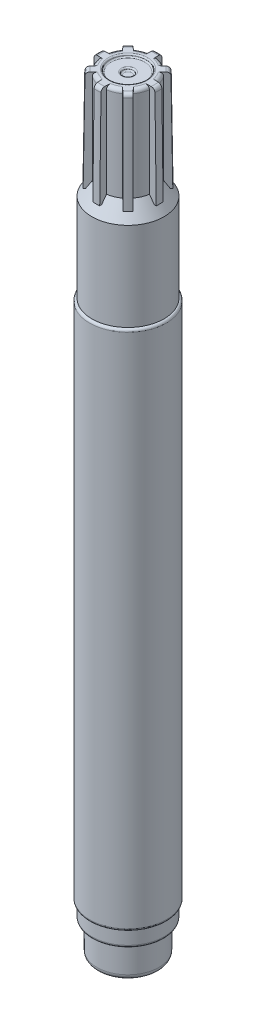
from build123d import *

# Parameters (mm, degrees)
FILLET1_R          = 0.475
CIRPATTERN1_COUNT  = 8
FILLET2_R          = 0.687
SKETCH6_R          = 3.43
CUT_EXTRUDE1_DEPTH = 0.5
SKETCH7_R          = 1
CUT_EXTRUDE2_DEPTH = 0.5
FILLET3_R          = 0.25
FILLET4_R          = 1
SKETCH8_W          = 0.43
SKETCH8_H          = 98.15
FILLET5_R          = 0.475


# Some blends are built 0.0001 mm under size
with BuildPart() as part:
    # Sketch2 → Revolve1 (revolve)
    with BuildSketch(Plane.XY, mode=Mode.PRIVATE) as revolve1_sk:
        Polygon((0, 72.25), (0, -72.25), (5.83, -72.25), (5.83, -66.25), (6.785, -66.25), (6.785, 51.55), (4.8, 54.55), (4.8, 72.25), align=None)
    revolve(revolve1_sk.sketch.rotate(Axis((0, 72.25, 0), (0, -1, 0)), 180), axis=Axis((0, 72.25, 0), (0, -1, 0)))

    # Fillet1
    fillet1_edges = [part.edges().sort_by_distance(p)[0] for p in [
        (6.785, -66.25, 0),
        (5.83, -66.25, 0),
    ]]
    fillet(fillet1_edges, radius=FILLET1_R)


with BuildPart() as body_2:
    # Sketch4 for Loft1 → Loft1 section 0
    with BuildSketch(Plane(origin=(0, 72.25, 0), x_dir=(1, 0, 0), z_dir=(0, 1, 0))):
        with BuildLine():
            Line((4.748684028, 0.7), (5.713142743, 0.65))
            # circular arc as an exact rational Bezier (weights 1, cos(half-angle), 1)
            Bezier((5.713142743, 0.65), (5.787095035, 0), (5.713142743, -0.65), weights=[1, 0.993590042, 1])
            Line((5.713142743, -0.65), (4.748684028, -0.7))
            Bezier((4.748684028, -0.7), (4.85187051, 0), (4.748684028, 0.7), weights=[1, 0.989309173, 1])
        make_face()
    # Sketch5 for Loft1 → Loft1 section 1
    with BuildSketch(Plane(origin=(0, 53.25, 0), x_dir=(1, 0, 0), z_dir=(0, 1, 0))):
        with BuildLine():
            Line((4.748684028, 0.7), (5.964687754, 0.65))
            Bezier((5.964687754, 0.65), (6.035521302, 0), (5.964687754, -0.65), weights=[1, 0.994114626, 1])
            Line((5.964687754, -0.65), (4.748684028, -0.7))
            Bezier((4.748684028, -0.7), (4.85187051, 0), (4.748684028, 0.7), weights=[1, 0.989309173, 1])
        make_face()
    loft()


with BuildPart() as cirpattern1_1:
    # CirPattern1: pattern copy
    add(body_2.part.rotate(Axis((0, 24.52235385, 0), (0, -1, 0)), 1 * 360 / CIRPATTERN1_COUNT))


with BuildPart() as cirpattern1_2:
    # CirPattern1: pattern copy
    add(body_2.part.rotate(Axis((0, 24.52235385, 0), (0, -1, 0)), 2 * 360 / CIRPATTERN1_COUNT))


with BuildPart() as cirpattern1_3:
    # CirPattern1: pattern copy
    add(body_2.part.rotate(Axis((0, 24.52235385, 0), (0, -1, 0)), 3 * 360 / CIRPATTERN1_COUNT))


with BuildPart() as cirpattern1_4:
    # CirPattern1: pattern copy
    add(body_2.part.rotate(Axis((0, 24.52235385, 0), (0, -1, 0)), 4 * 360 / CIRPATTERN1_COUNT))


with BuildPart() as cirpattern1_5:
    # CirPattern1: pattern copy
    add(body_2.part.rotate(Axis((0, 24.52235385, 0), (0, -1, 0)), 5 * 360 / CIRPATTERN1_COUNT))


with BuildPart() as cirpattern1_6:
    # CirPattern1: pattern copy
    add(body_2.part.rotate(Axis((0, 24.52235385, 0), (0, -1, 0)), 6 * 360 / CIRPATTERN1_COUNT))


with BuildPart() as cirpattern1_7:
    # CirPattern1: pattern copy
    add(body_2.part.rotate(Axis((0, 24.52235385, 0), (0, -1, 0)), 7 * 360 / CIRPATTERN1_COUNT))


with BuildPart() as part_1:
    add(part.part)

    # Combine1: union body 2, CirPattern1_1, CirPattern1_2, CirPattern1_3, CirPattern1_4, CirPattern1_5, CirPattern1_6, CirPattern1_7
    add(body_2.part)
    add(cirpattern1_1.part)
    add(cirpattern1_2.part)
    add(cirpattern1_3.part)
    add(cirpattern1_4.part)
    add(cirpattern1_5.part)
    add(cirpattern1_6.part)
    add(cirpattern1_7.part)

    # Fillet2
    fillet2_edges = [part_1.edges().sort_by_distance(p)[0] for p in [
        (-4.434621756, 72.25, 1.836880475),
        (-5.75, 72.25, 0),
        (-4.434621756, 72.25, -1.836880475),
        (-4.065863992, 72.25, -4.065863992),
        (-1.836880475, 72.25, -4.434621756),
        (0, 72.25, -5.75),
        (1.836880475, 72.25, -4.434621756),
        (4.065863992, 72.25, -4.065863992),
        (4.434621756, 72.25, -1.836880475),
        (5.75, 72.25, 0),
        (4.434621756, 72.25, 1.836880475),
        (4.065863992, 72.25, 4.065863992),
        (1.836880475, 72.25, 4.434621756),
        (0, 72.25, 5.75),
        (-1.836880475, 72.25, 4.434621756),
        (-4.065863992, 72.25, 4.065863992),
    ]]
    fillet(fillet2_edges, radius=FILLET2_R)

    # Sketch6 → Cut-Extrude1 (cut)
    with BuildSketch(Plane(origin=(0, 72.25, 0), x_dir=(1, 0, 0), z_dir=(0, 1, 0))):
        with Locations(Location((0, 0, 0), (0, 0, 180))):
            Circle(SKETCH6_R)
    extrude(amount=-CUT_EXTRUDE1_DEPTH, mode=Mode.SUBTRACT)

    # Sketch7 → Cut-Extrude2 (cut)
    with BuildSketch(Plane(origin=(0, 71.75, 0), x_dir=(1, 0, 0), z_dir=(0, 1, 0))):
        with Locations(Location((0, 0, 0), (0, 0, 180))):
            Circle(SKETCH7_R)
    extrude(amount=-CUT_EXTRUDE2_DEPTH, mode=Mode.SUBTRACT)

    # Fillet3
    fillet3_edges = [part_1.edges().sort_by_distance(p)[0] for p in [
        (3.43, 71.75, 0),
        (3.43, 72.25, 0),
        (1, 71.25, 0),
        (1, 71.75, 0),
    ]]
    fillet(fillet3_edges, radius=FILLET3_R - 0.0001)  # a hair under: the kernel refuses the full size

    # Fillet4
    fillet4_edges = [part_1.edges().sort_by_distance(p)[0] for p in [
        (5.83, -72.25, 0),
    ]]
    fillet(fillet4_edges, radius=FILLET4_R)

    # Sketch8 → Revolve2 (revolve)
    with BuildSketch(Plane.XY, mode=Mode.PRIVATE) as revolve2_sk:
        with Locations((7, -14.175)):
            Rectangle(SKETCH8_W, SKETCH8_H)
    revolve(revolve2_sk.sketch.rotate(Axis((0, 24.52235385, 0), (0, -1, 0)), 180), axis=Axis((0, 24.52235385, 0), (0, -1, 0)))

    # Fillet5
    # the kernel refuses this fillet: 0.475 mm, written as the material it takes off along each edge
    with BuildSketch(Plane(origin=(0, 34.9, 0), x_dir=(-1, 0, 0), z_dir=(0, 0, 1))) as fillet5_piece_1:
        with BuildLine():
            CenterArc((6.74, 0.472863617), FILLET5_R, 275.436173664, 84.563826336)
            Line((6.785, 0), (6.7859, -0.009457272))
            ThreePointArc((6.7859, -0.009457272), (7, -0.0095), (7.215, -0.0095))
            Line((7.215, -0.0095), (7.2245, 0))
            Line((7.2245, 0), (7.2245, 0.472863617))
            Line((7.2245, 0.472863617), (7.215, 0.472863617))
        make_face()
    revolve(axis=Axis((0, 34.9, 0), (0, -1, 0)), mode=Mode.SUBTRACT)
    with BuildSketch(Plane(origin=(0, -63.25, 0), x_dir=(-1, 0, 0), z_dir=(0, 0, 1))) as fillet5_piece_2:
        with BuildLine():
            CenterArc((6.74, -0.472863617), FILLET5_R, 0, 84.563826336)
            Line((7.215, -0.472863617), (7.2245, -0.472863617))
            Line((7.2245, -0.472863617), (7.2245, 0))
            Line((7.2245, 0), (7.215, 0.0095))
            ThreePointArc((7.215, 0.0095), (7, 0.0095), (6.7859, 0.009457272))
            Line((6.7859, 0.009457272), (6.785, 0))
        make_face()
    revolve(axis=Axis((0, -63.25, 0), (0, -1, 0)), mode=Mode.SUBTRACT)


solid = part_1.part
